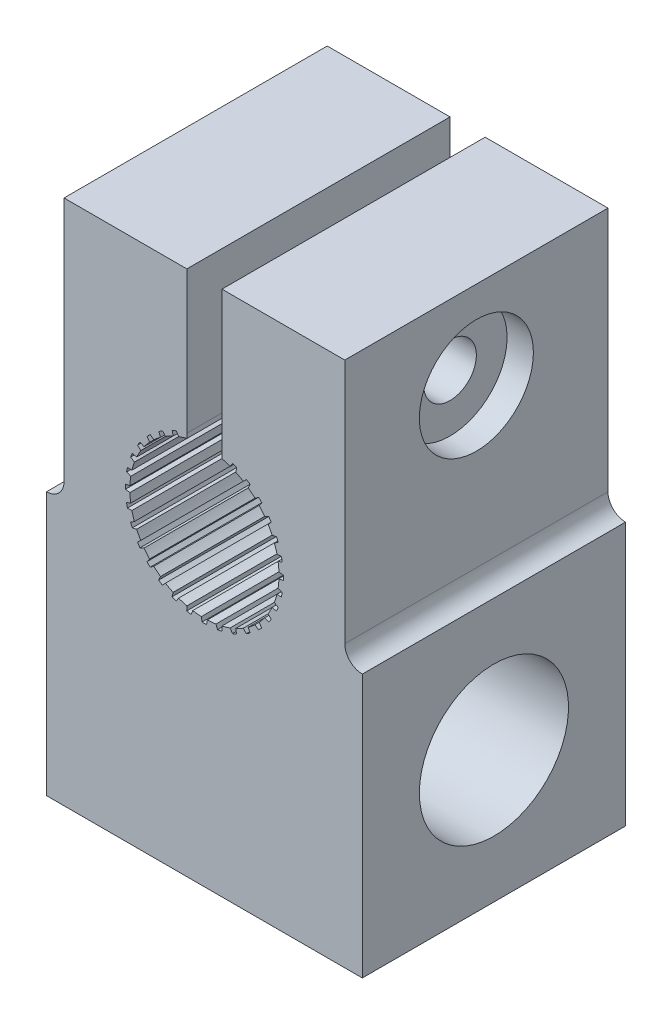
from build123d import *

# Parameters (mm, degrees)
ESTRUSIONE_ESTRUSIONE1_DEPTH  = 7.5
TAGLIO_ESTRUSIONE1_DEPTH      = 36.288099977
TAGLIO_ESTRUSIONE1_DEPTH_BACK = 36.288099977
SCHIZZO2_R                    = 1.5
SCHIZZO5_R                    = 3.25
SCHIZZO5_R_2                  = 1.5
TAGLIO_ESTRUSIONE2_DEPTH      = 1.5
TAGLIO_ESTRUSIONE3_DEPTH      = 2.4
SCHIZZO7_R                    = 4.25
TAGLIO_ESTRUSIONE4_DEPTH      = 36.780581326
RACCORDO1_R                   = 1
RACCORDO2_R                   = 1


with BuildPart() as part:
    # Schizzo1 → Estrusione-Estrusione1 (new, symmetric)
    with BuildSketch(Plane.XY):
        with BuildLine():
            Line((0, 0), (0, 15))
            Line((0, 15), (1, 15))
            Line((1, 15), (1, 30))
            Line((1, 30), (8, 30))
            Line((8, 30), (8, 21.887482194))
            Line((8, 21.887482194), (8.008157942, 21.632644351))
            ThreePointArc((8.008157942, 21.632644351), (7.769233188, 21.567888034), (7.534483906, 21.489331094))
            Line((7.534483906, 21.489331094), (7.4, 21.705948169))
            ThreePointArc((7.4, 21.705948169), (7.280933204, 21.658702845), (7.163259406, 21.608087632))
            Line((7.163259406, 21.608087632), (7.220976992, 21.359737962))
            ThreePointArc((7.220976992, 21.359737962), (6.999276441, 21.249614012), (6.784363499, 21.126769209))
            Line((6.784363499, 21.126769209), (6.610203769, 21.312987539))
            ThreePointArc((6.610203769, 21.312987539), (6.502641913, 21.243421241), (6.397103722, 21.170821566))
            Line((6.397103722, 21.170821566), (6.502162898, 20.938504008))
            ThreePointArc((6.502162898, 20.938504008), (6.306206378, 20.787244427), (6.11938876, 20.624832617))
            Line((6.11938876, 20.624832617), (5.912246066, 20.773495936))
            ThreePointArc((5.912246066, 20.773495936), (5.820322693, 20.684282058), (5.730975883, 20.592487886))
            Line((5.730975883, 20.592487886), (5.879339283, 20.385130273))
            ThreePointArc((5.879339283, 20.385130273), (5.716657294, 20.198547882), (5.565114296, 20.00281046))
            Line((5.565114296, 20.00281046), (5.332949016, 20.108205721))
            ThreePointArc((5.332949016, 20.108205721), (5.260196689, 20.002772701), (5.190474807, 19.89531163))
            Line((5.190474807, 19.89531163), (5.37644091, 19.720882599))
            ThreePointArc((5.37644091, 19.720882599), (5.253285228, 19.506147655), (5.142840563, 19.284606701))
            Line((5.142840563, 19.284606701), (4.894574679, 19.342683622))
            ThreePointArc((4.894574679, 19.342683622), (4.843789229, 19.225083194), (4.796371648, 19.106084892))
            Line((4.796371648, 19.106084892), (5.01279388, 18.971287653))
            ThreePointArc((5.01279388, 18.971287653), (4.933897309, 18.736652299), (4.868795304, 18.497821507))
            Line((4.868795304, 18.497821507), (4.613969534, 18.506348225))
            ThreePointArc((4.613969534, 18.506348225), (4.587102618, 18.381099706), (4.56381157, 18.255137213))
            Line((4.56381157, 18.255137213), (4.802372946, 18.165151948))
            ThreePointArc((4.802372946, 18.165151948), (4.770767437, 17.919633089), (4.753509925, 17.672690592))
            Line((4.753509925, 17.672690592), (4.50191708, 17.63133943))
            ThreePointArc((4.50191708, 17.63133943), (4.500001178, 17.503256051), (4.501731724, 17.375170034))
            Line((4.501731724, 17.375170034), (4.753264465, 17.333454826))
            ThreePointArc((4.753264465, 17.333454826), (4.770164601, 17.086487614), (4.801414778, 16.840923275))
            Line((4.801414778, 16.840923275), (4.562723431, 16.751283334))
            ThreePointArc((4.562723431, 16.751283334), (4.58583217, 16.625287267), (4.612517806, 16.5))
            Line((4.612517806, 16.5), (4.867355649, 16.508157942))
            ThreePointArc((4.867355649, 16.508157942), (4.932111966, 16.269233188), (5.010668906, 16.034483906))
            Line((5.010668906, 16.034483906), (4.794051831, 15.9))
            ThreePointArc((4.794051831, 15.9), (4.841297155, 15.780933204), (4.891912368, 15.663259406))
            Line((4.891912368, 15.663259406), (5.140262038, 15.720976992))
            ThreePointArc((5.140262038, 15.720976992), (5.250385988, 15.499276441), (5.373230791, 15.284363499))
            Line((5.373230791, 15.284363499), (5.187012461, 15.110203769))
            ThreePointArc((5.187012461, 15.110203769), (5.256578759, 15.002641913), (5.329178434, 14.897103722))
            Line((5.329178434, 14.897103722), (5.561495992, 15.002162898))
            ThreePointArc((5.561495992, 15.002162898), (5.712755573, 14.806206378), (5.875167383, 14.61938876))
            Line((5.875167383, 14.61938876), (5.726504064, 14.412246066))
            ThreePointArc((5.726504064, 14.412246066), (5.815717942, 14.320322693), (5.907512114, 14.230975883))
            Line((5.907512114, 14.230975883), (6.114869727, 14.379339283))
            ThreePointArc((6.114869727, 14.379339283), (6.301452118, 14.216657294), (6.49718954, 14.065114296))
            Line((6.49718954, 14.065114296), (6.391794279, 13.832949016))
            ThreePointArc((6.391794279, 13.832949016), (6.497227299, 13.760196689), (6.60468837, 13.690474807))
            Line((6.60468837, 13.690474807), (6.779117401, 13.87644091))
            ThreePointArc((6.779117401, 13.87644091), (6.993852345, 13.753285228), (7.215393299, 13.642840563))
            Line((7.215393299, 13.642840563), (7.157316378, 13.394574679))
            ThreePointArc((7.157316378, 13.394574679), (7.274916806, 13.343789229), (7.393915108, 13.296371648))
            Line((7.393915108, 13.296371648), (7.528712347, 13.51279388))
            ThreePointArc((7.528712347, 13.51279388), (7.763347701, 13.433897309), (8.002178493, 13.368795304))
            Line((8.002178493, 13.368795304), (7.993651775, 13.113969534))
            ThreePointArc((7.993651775, 13.113969534), (8.118900294, 13.087102618), (8.244862787, 13.06381157))
            Line((8.244862787, 13.06381157), (8.334848052, 13.302372946))
            ThreePointArc((8.334848052, 13.302372946), (8.580366911, 13.270767437), (8.827309408, 13.253509925))
            Line((8.827309408, 13.253509925), (8.86866057, 13.00191708))
            ThreePointArc((8.86866057, 13.00191708), (8.996743949, 13.000001178), (9.124829966, 13.001731724))
            Line((9.124829966, 13.001731724), (9.166545174, 13.253264465))
            ThreePointArc((9.166545174, 13.253264465), (9.413512386, 13.270164601), (9.659076725, 13.301414778))
            Line((9.659076725, 13.301414778), (9.748716666, 13.062723431))
            ThreePointArc((9.748716666, 13.062723431), (9.874712733, 13.08583217), (10, 13.112517806))
            Line((10, 13.112517806), (9.991842058, 13.367355649))
            ThreePointArc((9.991842058, 13.367355649), (10.230766812, 13.432111966), (10.465516094, 13.510668906))
            Line((10.465516094, 13.510668906), (10.6, 13.294051831))
            ThreePointArc((10.6, 13.294051831), (10.719066796, 13.341297155), (10.836740594, 13.391912368))
            Line((10.836740594, 13.391912368), (10.779023008, 13.640262038))
            ThreePointArc((10.779023008, 13.640262038), (11.000723559, 13.750385988), (11.215636501, 13.873230791))
            Line((11.215636501, 13.873230791), (11.389796231, 13.687012461))
            ThreePointArc((11.389796231, 13.687012461), (11.497358087, 13.756578759), (11.602896278, 13.829178434))
            Line((11.602896278, 13.829178434), (11.497837102, 14.061495992))
            ThreePointArc((11.497837102, 14.061495992), (11.693793622, 14.212755573), (11.88061124, 14.375167383))
            Line((11.88061124, 14.375167383), (12.087753934, 14.226504064))
            ThreePointArc((12.087753934, 14.226504064), (12.179677307, 14.315717942), (12.269024117, 14.407512114))
            Line((12.269024117, 14.407512114), (12.120660717, 14.614869727))
            ThreePointArc((12.120660717, 14.614869727), (12.283342706, 14.801452118), (12.434885704, 14.99718954))
            Line((12.434885704, 14.99718954), (12.667050984, 14.891794279))
            ThreePointArc((12.667050984, 14.891794279), (12.739803311, 14.997227299), (12.809525193, 15.10468837))
            Line((12.809525193, 15.10468837), (12.62355909, 15.279117401))
            ThreePointArc((12.62355909, 15.279117401), (12.746714772, 15.493852345), (12.857159437, 15.715393299))
            Line((12.857159437, 15.715393299), (13.105425321, 15.657316378))
            ThreePointArc((13.105425321, 15.657316378), (13.156210771, 15.774916806), (13.203628352, 15.893915108))
            Line((13.203628352, 15.893915108), (12.98720612, 16.028712347))
            ThreePointArc((12.98720612, 16.028712347), (13.066102691, 16.263347701), (13.131204696, 16.502178493))
            Line((13.131204696, 16.502178493), (13.386030466, 16.493651775))
            ThreePointArc((13.386030466, 16.493651775), (13.412897382, 16.618900294), (13.43618843, 16.744862787))
            Line((13.43618843, 16.744862787), (13.197627054, 16.834848052))
            ThreePointArc((13.197627054, 16.834848052), (13.229232563, 17.080366911), (13.246490075, 17.327309408))
            Line((13.246490075, 17.327309408), (13.49808292, 17.36866057))
            ThreePointArc((13.49808292, 17.36866057), (13.499998822, 17.496743949), (13.498268276, 17.624829966))
            Line((13.498268276, 17.624829966), (13.246735535, 17.666545174))
            ThreePointArc((13.246735535, 17.666545174), (13.229835399, 17.913512386), (13.198585222, 18.159076725))
            Line((13.198585222, 18.159076725), (13.437276569, 18.248716666))
            ThreePointArc((13.437276569, 18.248716666), (13.41416783, 18.374712733), (13.387482194, 18.5))
            Line((13.387482194, 18.5), (13.132644351, 18.491842058))
            ThreePointArc((13.132644351, 18.491842058), (13.067888034, 18.730766812), (12.989331094, 18.965516094))
            Line((12.989331094, 18.965516094), (13.205948169, 19.1))
            ThreePointArc((13.205948169, 19.1), (13.158702845, 19.219066796), (13.108087632, 19.336740594))
            Line((13.108087632, 19.336740594), (12.859737962, 19.279023008))
            ThreePointArc((12.859737962, 19.279023008), (12.749614012, 19.500723559), (12.626769209, 19.715636501))
            Line((12.626769209, 19.715636501), (12.812987539, 19.889796231))
            ThreePointArc((12.812987539, 19.889796231), (12.743421241, 19.997358087), (12.670821566, 20.102896278))
            Line((12.670821566, 20.102896278), (12.438504008, 19.997837102))
            ThreePointArc((12.438504008, 19.997837102), (12.287244427, 20.193793622), (12.124832617, 20.38061124))
            Line((12.124832617, 20.38061124), (12.273495936, 20.587753934))
            ThreePointArc((12.273495936, 20.587753934), (12.184282058, 20.679677307), (12.092487886, 20.769024117))
            Line((12.092487886, 20.769024117), (11.885130273, 20.620660717))
            ThreePointArc((11.885130273, 20.620660717), (11.698547882, 20.783342706), (11.50281046, 20.934885704))
            Line((11.50281046, 20.934885704), (11.608205721, 21.167050984))
            ThreePointArc((11.608205721, 21.167050984), (11.502772701, 21.239803311), (11.39531163, 21.309525193))
            Line((11.39531163, 21.309525193), (11.220882599, 21.12355909))
            ThreePointArc((11.220882599, 21.12355909), (11.006147655, 21.246714772), (10.784606701, 21.357159437))
            Line((10.784606701, 21.357159437), (10.842683622, 21.605425321))
            ThreePointArc((10.842683622, 21.605425321), (10.725083194, 21.656210771), (10.606084892, 21.703628352))
            Line((10.606084892, 21.703628352), (10.471287653, 21.48720612))
            ThreePointArc((10.471287653, 21.48720612), (10.236652299, 21.566102691), (9.997821507, 21.631204696))
            Line((9.997821507, 21.631204696), (10.006348225, 21.886030466))
            ThreePointArc((10.006348225, 21.886030466), (10.003174375, 21.886757478), (10, 21.887482194))
            Line((10, 21.887482194), (10, 30))
            Line((10, 30), (17, 30))
            Line((17, 30), (17, 15))
            Line((17, 15), (18, 15))
            Line((18, 15), (18, 0))
            Line((18, 0), (0, 0))
        make_face()
    extrude(amount=ESTRUSIONE_ESTRUSIONE1_DEPTH, both=True)

    # Schizzo2 → Taglio-Estrusione1 (cut, two sides: drawn at the far end of the back side and taken through both)
    with BuildSketch(Plane(origin=(17, 0, 0), x_dir=(0, 0, -1), z_dir=(1, 0, 0)).offset(-TAGLIO_ESTRUSIONE1_DEPTH_BACK)):
        with Locations((0, 25)):
            Circle(SCHIZZO2_R)
    extrude(amount=TAGLIO_ESTRUSIONE1_DEPTH + TAGLIO_ESTRUSIONE1_DEPTH_BACK, mode=Mode.SUBTRACT)

    # Schizzo5 → Taglio-Estrusione2 (cut)
    with BuildSketch(Plane(origin=(17, 0, 0), x_dir=(0, 0, -1), z_dir=(1, 0, 0))):
        with Locations((0, 25)):
            Circle(SCHIZZO5_R)
        with Locations((0, 25)):
            Circle(SCHIZZO5_R_2, mode=Mode.SUBTRACT)
    extrude(amount=-TAGLIO_ESTRUSIONE2_DEPTH, mode=Mode.SUBTRACT)

    # Schizzo6 → Taglio-Estrusione3 (cut)
    with BuildSketch(Plane.ZY.offset(-1)):
        Polygon((3, 25), (1.5, 27.598076211), (-1.5, 27.598076211), (-3, 25), (-1.5, 22.401923789), (1.5, 22.401923789), align=None)
    extrude(amount=-TAGLIO_ESTRUSIONE3_DEPTH, mode=Mode.SUBTRACT)

    # Schizzo7 → Taglio-Estrusione4 (cut, through all)
    with BuildSketch(Plane.ZY):
        with Locations((0, 7.5)):
            Circle(SCHIZZO7_R)
    extrude(amount=-TAGLIO_ESTRUSIONE4_DEPTH, mode=Mode.SUBTRACT)

    # Raccordo1
    raccordo1_edges = [part.edges().sort_by_distance(p)[0] for p in [
        (17, 15, 0),
    ]]
    fillet(raccordo1_edges, radius=RACCORDO1_R - 0.0001)  # a hair under: the kernel refuses the full size

    # Raccordo2
    raccordo2_edges = [part.edges().sort_by_distance(p)[0] for p in [
        (1, 15, 0),
    ]]
    fillet(raccordo2_edges, radius=RACCORDO2_R - 0.0001)  # a hair under: the kernel refuses the full size


solid = part.part
